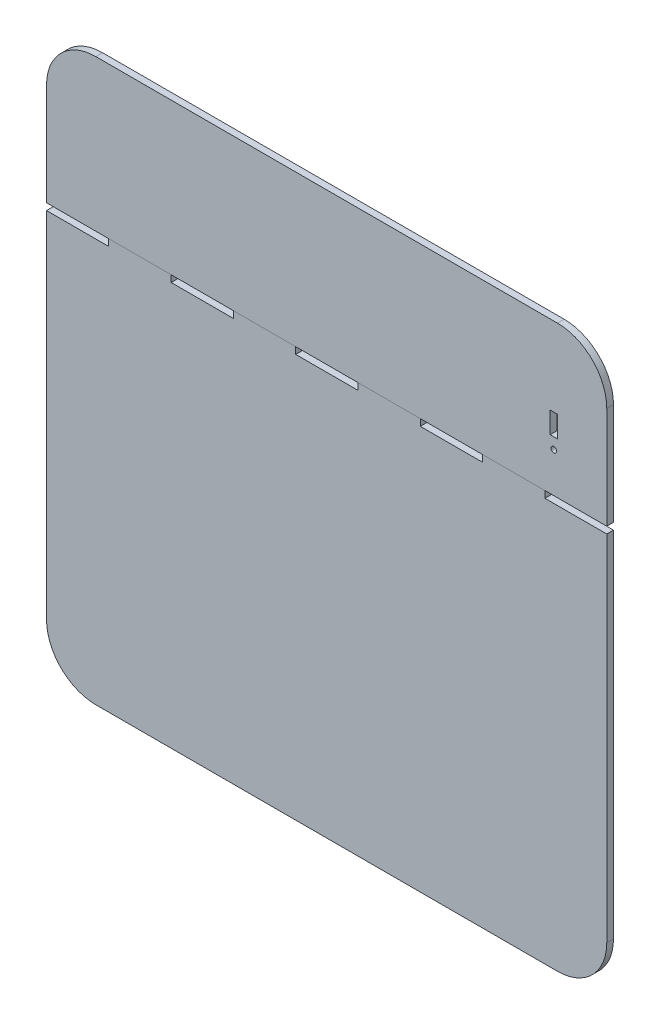
from build123d import *

# Parameters (mm, degrees)
SKETCH1_W              = 500
SKETCH1_H              = 501
BOSS_EXTRUDE1_DEPTH    = 6
FILLET1_R              = 44
SKETCH2_W              = 55.5
SKETCH2_H              = 6
CUT_EXTRUDE1_DEPTH     = 10
LPATTERN1_COUNT        = 5
LPATTERN1_PITCH        = 111.2
SKETCH4_W              = 6.5
SKETCH4_H              = 19
CUT_EXTRUDE3_DEPTH     = 10
SKETCH3_R              = 2.5
CUT_EXTRUDE2_DEPTH     = 10
SPLIT1_SURFACE_1_BACK  = 708.84
SPLIT1_SURFACE_1_DEPTH = 1417.68
SPLIT1_SURFACE_2_BACK  = 708.84
SPLIT1_SURFACE_2_DEPTH = 1417.68


with BuildPart() as part:
    # Sketch1 → Boss-Extrude1 (new body)
    with BuildSketch(Plane.XY):
        with Locations((250, 250.5)):
            Rectangle(SKETCH1_W, SKETCH1_H)
    extrude(amount=BOSS_EXTRUDE1_DEPTH)

    # Fillet1
    fillet1_edges = [part.edges().sort_by_distance(p)[0] for p in [
        (0, 0, 3),
        (0, 501, 3),
        (500, 0, 3),
        (500, 501, 3),
    ]]
    fillet(fillet1_edges, radius=FILLET1_R)

    # Sketch2 → Cut-Extrude1 (cut)
    with BuildSketch(Plane(origin=(0, 0, 0), x_dir=(-1, 0, 0), z_dir=(0, 0, -1))):
        with Locations((-27.75, 363)):
            Rectangle(SKETCH2_W, SKETCH2_H)
    cut_extrude1 = extrude(amount=-CUT_EXTRUDE1_DEPTH, mode=Mode.SUBTRACT)

    # LPattern1: Cut-Extrude1 ×5
    with Locations(*[(i * LPATTERN1_PITCH, 0, 0) for i in range(1, LPATTERN1_COUNT)]):
        add(cut_extrude1, mode=Mode.SUBTRACT)

    # Sketch4 → Cut-Extrude3 (cut)
    with BuildSketch(Plane(origin=(0, 0, 0), x_dir=(-1, 0, 0), z_dir=(0, 0, -1))):
        with Locations((-452.75, 421)):
            Rectangle(SKETCH4_W, SKETCH4_H)
    extrude(amount=-CUT_EXTRUDE3_DEPTH, mode=Mode.SUBTRACT)

    # Sketch3 → Cut-Extrude2 (cut)
    with BuildSketch(Plane(origin=(0, 0, 0), x_dir=(-1, 0, 0), z_dir=(0, 0, -1))):
        with Locations((-452.75, 401.5)):
            Circle(SKETCH3_R)
    extrude(amount=-CUT_EXTRUDE2_DEPTH, mode=Mode.SUBTRACT)


with BuildPart() as body_2:
    # Split1: the piece behind the surface
    add(part.part)
    # Split1 surface: a surface, the sketch's curves swept straight by 1417.68 mm
    with BuildLine(Plane.XY.offset(6).offset(-SPLIT1_SURFACE_1_BACK), mode=Mode.PRIVATE) as split1_surface_1_path:
        Line((0, 366), (500, 366))
    split1_surface_1 = Shell.extrude(split1_surface_1_path.wire(), (0 * SPLIT1_SURFACE_1_DEPTH, 0 * SPLIT1_SURFACE_1_DEPTH, 1 * SPLIT1_SURFACE_1_DEPTH))
    split(bisect_by=split1_surface_1, keep=Keep.BOTTOM)


with BuildPart() as part_1:
    add(part.part)

    # Split1: split by a surface, the side it looks to stays
    # Split1 surface: a surface, the sketch's curves swept straight by 1417.68 mm
    with BuildLine(Plane.XY.offset(6).offset(-SPLIT1_SURFACE_2_BACK), mode=Mode.PRIVATE) as split1_surface_2_path:
        Line((0, 366), (500, 366))
    split1_surface_2 = Shell.extrude(split1_surface_2_path.wire(), (0 * SPLIT1_SURFACE_2_DEPTH, 0 * SPLIT1_SURFACE_2_DEPTH, 1 * SPLIT1_SURFACE_2_DEPTH))
    split(bisect_by=split1_surface_2, keep=Keep.TOP)


solid = Compound([body_2.part, part_1.part])
